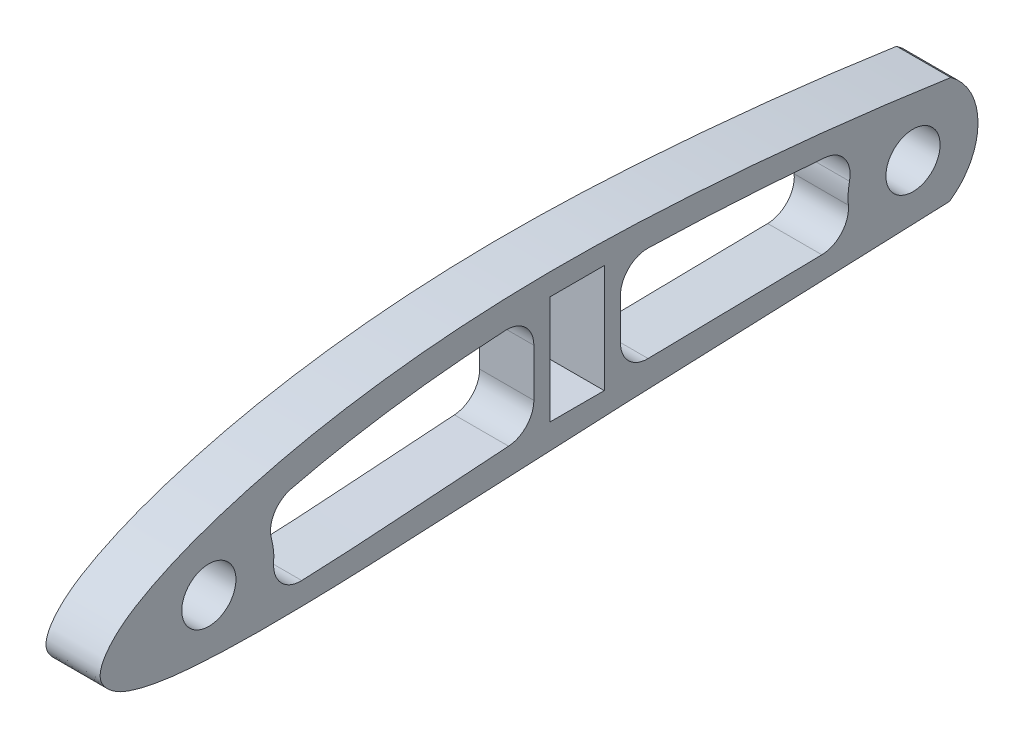
from build123d import *

# Parameters (mm, degrees)
SALIENTE_EXTRUIR1_DEPTH = 5
CROQUIS3_R              = 2.5
CORTAR_EXTRUIR1_DEPTH   = 5
CROQUIS5_W              = 5
CROQUIS5_H              = 10
CORTAR_EXTRUIR2_DEPTH   = 5
REDONDEO1_DEPTH         = 5
REDONDEO2_R             = 1
CORTAR_EXTRUIR3_DEPTH   = 121.736658037


with BuildPart() as part:
    # Croquis2 → Saliente-Extruir1 (new body)
    with BuildSketch(Plane(origin=(0, 0, 0), x_dir=(0, 0, -1), z_dir=(1, 0, 0))):
        with BuildLine():
            Line((0, 0.312), (0, 0))
            add(Edge.make_bspline(
                [(0, 0.312), (-1.997937962, 0.855883829), (-5.984172101, 1.941026774), (-13.969754476, 3.914084328), (-23.956000464, 6.094072944), (-35.967556114, 8.243020219), (-47.969800137, 10.004487706), (-59.978731703, 11.260941512), (-71.986616918, 12.044579605), (-82.010943729, 12.052504921), (-90.01480163, 11.498771412), (-96.025805434, 10.769404695), (-102.049800649, 9.693800408), (-107.041673173, 8.400233687), (-111.041923446, 7.093785184), (-114.058204626, 5.860437414), (-116.631860078, 4.526604372), (-118.865795122, 2.93110484), (-120.810450078, 0.365036715), (-118.71145095, -1.597439419), (-116.569629865, -2.367784281), (-114.018868253, -2.887733145), (-111.006425112, -3.152089705), (-107.001663144, -3.339180047), (-101.998747691, -3.325166853), (-95.997395823, -3.157228981), (-90.000278469, -2.837463999), (-82.000247102, -2.463308415), (-72.001915622, -1.983166009), (-59.999653911, -1.532308544), (-48.001247876, -1.031669763), (-36.00169377, -0.605253895), (-24.001178347, -0.29159827), (-14.000300294, -0.132346287), (-6.000182393, -0.027470629), (-2.000024799, -0.009156712), (0, 0)],
                knots=[0, 0, 0, 0, 0.025304886, 0.050487653, 0.100520433, 0.150190716, 0.199586607, 0.248740009, 0.297715539, 0.346600594, 0.371102737, 0.395726297, 0.420570145, 0.445825119, 0.458702216, 0.471919982, 0.485786003, 0.493461051, 0.506863029, 0.51614777, 0.522766003, 0.535269014, 0.547551134, 0.559786371, 0.584228898, 0.60868081, 0.633151284, 0.657621757, 0.706558114, 0.75548187, 0.804405627, 0.853320224, 0.902221408, 0.951113136, 0.975557228, 1, 1, 1, 1], degree=3))
        make_face()
    extrude(amount=SALIENTE_EXTRUIR1_DEPTH)

    # Croquis3 → Cortar-Extruir1 (cut)
    with BuildSketch(Plane(origin=(5, 0, 0), x_dir=(0, 0, -1), z_dir=(1, 0, 0))):
        with Locations((-110, 1.906)):
            Circle(CROQUIS3_R)
        with Locations((-45, 4.156)):
            Circle(CROQUIS3_R)
        with BuildLine():
            Line((-72.000000017, 9.416000001), (-72.000000017, 0.495999999))
            add(Edge.make_bspline(
                [(-72.000000017, 0.495999999), (-68.01129666, 0.575920018), (-60.685821656, 0.684456619), (-53.360874788, 0.820935125), (-50.024643764, 0.876830129)],
                knots=[0.706558114, 0.706558114, 0.706558114, 0.706558114, 0.75548187, 0.796400089, 0.796400089, 0.796400089, 0.796400089], degree=3))
            ThreePointArc((-50.024643764, 0.876830129), (-50.985037611, 4.579467585), (-49.512866043, 8.109990399))
            add(Edge.make_bspline(
                [(-49.512866043, 8.109990399), (-52.983421467, 8.449081108), (-60.471100907, 9.046835898), (-67.976381823, 9.371658422), (-72.000000017, 9.416000001)],
                knots=[0.206289007, 0.206289007, 0.206289007, 0.206289007, 0.248740009, 0.297715539, 0.297715539, 0.297715539, 0.297715539], degree=3))
        make_face()
        with BuildLine():
            Line((-80, 9.491041744), (-80, 0.132962651))
            add(Edge.make_bspline(
                [(-104.942522523, -1.322300105), (-104.02844512, -1.304513093), (-101.094064778, -1.218428736), (-96.141207098, -0.982427522), (-90.090644536, -0.540517181), (-84.708866135, -0.182788773), (-81.345393913, 0.043128867), (-80, 0.132962651)],
                knots=[0.57316863, 0.57316863, 0.57316863, 0.57316863, 0.584228898, 0.60868081, 0.633151284, 0.657621757, 0.673934787, 0.673934787, 0.673934787, 0.673934787], degree=3))
            ThreePointArc((-104.942522523, -1.322300105), (-104.014074088, 2.316720069), (-105.430858936, 5.794823721))
            add(Edge.make_bspline(
                [(-80, 9.491041744), (-81.321099881, 9.446121253), (-84.626183418, 9.287675361), (-89.912800709, 8.827841386), (-95.854977781, 7.999925906), (-101.037837976, 6.979596219), (-104.212985807, 6.146867345), (-105.430858936, 5.794823721)],
                knots=[0.33030001, 0.33030001, 0.33030001, 0.33030001, 0.346600594, 0.371102737, 0.395726297, 0.420570145, 0.436202252, 0.436202252, 0.436202252, 0.436202252], degree=3))
        make_face()
        with BuildLine():
            ThreePointArc((-39.747862708, 1.255128774), (-39.007320379, 3.859704601), (-39.487323452, 6.524627721))
            add(Edge.make_bspline(
                [(-15, 1.848248895), (-18.149785119, 2.575980355), (-25.155220919, 4.084600766), (-33.337238661, 5.554150579), (-38.353786594, 6.350514551), (-39.487323452, 6.524627721)],
                knots=[0.059687027, 0.059687027, 0.059687027, 0.059687027, 0.100520433, 0.150190716, 0.164676314, 0.164676314, 0.164676314, 0.164676314], degree=3))
            add(Edge.make_bspline(
                [(-39.747862708, 1.255128774), (-38.522933592, 1.296668404), (-33.432243502, 1.462543319), (-25.183187553, 1.68029012), (-18.158050573, 1.800552691), (-15, 1.848248895)],
                knots=[0.837824168, 0.837824168, 0.837824168, 0.837824168, 0.853320224, 0.902221408, 0.942154078, 0.942154078, 0.942154078, 0.942154078], degree=3))
        make_face()
    extrude(amount=-CORTAR_EXTRUIR1_DEPTH, mode=Mode.SUBTRACT)

    # Croquis5 → Cortar-Extruir2 (cut)
    with BuildSketch(Plane(origin=(5, 0, 0), x_dir=(0, 0, -1), z_dir=(1, 0, 0))):
        with Locations((-76.000000008, 5)):
            Rectangle(CROQUIS5_W, CROQUIS5_H)
    extrude(amount=-CORTAR_EXTRUIR2_DEPTH, mode=Mode.SUBTRACT)

    # Redondeo1: read off the stored shape, not the designer's step
    # Redondeo1 outline → Redondeo1 (add)
    with BuildSketch(Plane.YZ):
        with BuildLine():
            ThreePointArc((1.363625327, 36.42666084), (2.055490703, 38.232815236), (3.828859747, 39.004847381))
            ThreePointArc((3.828859747, 39.004847381), (5.523952088, 38.02298814), (5.990815999, 36.120509834))
            add(Edge.make_bspline(
                [(5.990815999, 36.120509834), (6.174011226, 37.241939564), (6.352115292, 38.364207973), (6.524627721, 39.487323452)],
                knots=[0.150323892, 0.150323892, 0.150323892, 0.150323892, 0.164676314, 0.164676314, 0.164676314, 0.164676314], degree=3))
            ThreePointArc((6.524627721, 39.487323452), (3.859704602, 39.007320379), (1.255128774, 39.747862708))
            add(Edge.make_bspline(
                [(1.255128774, 39.747862708), (1.292669932, 38.640841355), (1.328884057, 37.53377482), (1.363625327, 36.42666084)],
                knots=[0.837824168, 0.837824168, 0.837824168, 0.837824168, 0.851828623, 0.851828623, 0.851828623, 0.851828623], degree=3))
        make_face()
        with BuildLine():
            ThreePointArc((3.507984743, 104.217816599), (5.438808007, 103.965886257), (6.603235414, 102.405227362))
            add(Edge.make_bspline(
                [(6.603235414, 102.405227362), (6.354095177, 103.418967512), (6.084783867, 104.427759758), (5.794823721, 105.430858936)],
                knots=[0.423326893, 0.423326893, 0.423326893, 0.423326893, 0.436202252, 0.436202252, 0.436202252, 0.436202252], degree=3))
            ThreePointArc((5.794823721, 105.430858936), (4.717603159, 104.699538919), (3.507984743, 104.217816599))
        make_face()
        with BuildLine():
            add(Edge.make_bspline(
                [(9.491041744, 80), (9.461187046, 80.878018844), (9.423214515, 81.755716332), (9.376506926, 82.632925827)],
                knots=[0.33030001, 0.33030001, 0.33030001, 0.33030001, 0.341133574, 0.341133574, 0.341133574, 0.341133574], degree=3))
            ThreePointArc((9.376506926, 82.632925827), (8.694197985, 80.779871308), (6.880043283, 80))
            Line((6.880043283, 80), (9.491041744, 80))
        make_face()
        with BuildLine():
            ThreePointArc((-1.217346892, 101.42745145), (-0.455395505, 103.321781492), (1.464700492, 104.016250779))
            ThreePointArc((1.464700492, 104.016250779), (0.013650887, 104.306230174), (-1.322300105, 104.942522523))
            add(Edge.make_bspline(
                [(-1.322300105, 104.942522523), (-1.304513093, 104.02844512), (-1.270137307, 102.856668551), (-1.227208305, 101.685224677), (-1.217346892, 101.42745145)],
                knots=[0.57316863, 0.57316863, 0.57316863, 0.57316863, 0.584228898, 0.587349593, 0.587349593, 0.587349593, 0.587349593], degree=3))
        make_face()
        with BuildLine():
            Line((0.132962651, 80), (2.471241745, 80))
            ThreePointArc((2.471241745, 80), (0.76358821, 80.674097646), (-0.023165141, 82.332864476))
            add(Edge.make_bspline(
                [(-0.023165141, 82.332864476), (0.028938373, 81.555247835), (0.081039245, 80.777629876), (0.132962651, 80)],
                knots=[0.66450595, 0.66450595, 0.66450595, 0.66450595, 0.673934787, 0.673934787, 0.673934787, 0.673934787], degree=3))
        make_face()
        with BuildLine():
            ThreePointArc((8.438158575, 53.096140642), (7.43338444, 51.298795363), (5.420409596, 50.865259446))
            ThreePointArc((5.420409596, 50.865259446), (6.8513973, 50.360488167), (8.109990399, 49.512866043))
            add(Edge.make_bspline(
                [(8.109990399, 49.512866043), (8.226624149, 50.706599409), (8.335976911, 51.901055686), (8.438158575, 53.096140642)],
                knots=[0.206289007, 0.206289007, 0.206289007, 0.206289007, 0.220890467, 0.220890467, 0.220890467, 0.220890467], degree=3))
        make_face()
        with BuildLine():
            ThreePointArc((0.876830129, 50.024643764), (2.163659753, 50.65955655), (3.564442647, 50.970767111))
            ThreePointArc((3.564442647, 50.970767111), (1.655977789, 51.591017802), (0.818348025, 53.414565283))
            add(Edge.make_bspline(
                [(0.818348025, 53.414565283), (0.838248228, 52.2845983), (0.857898456, 51.154627293), (0.876830129, 50.024643764)],
                knots=[0.782541063, 0.782541063, 0.782541063, 0.782541063, 0.796400089, 0.796400089, 0.796400089, 0.796400089], degree=3))
        make_face()
        with BuildLine():
            ThreePointArc((6.871491343, 72.000000017), (8.660450653, 71.246317453), (9.370764011, 69.439699686))
            add(Edge.make_bspline(
                [(9.370764011, 69.439699686), (9.391351193, 70.29297827), (9.406593246, 71.146417681), (9.416000001, 72.000000017)],
                knots=[0.287325724, 0.287325724, 0.287325724, 0.287325724, 0.297715539, 0.297715539, 0.297715539, 0.297715539], degree=3))
            Line((9.416000001, 72.000000017), (6.871491343, 72.000000017))
        make_face()
        with BuildLine():
            add(Edge.make_bspline(
                [(0.495999999, 72.000000017), (0.512999759, 71.151564312), (0.529057688, 70.303110091), (0.544453868, 69.4546428)],
                knots=[0.706558114, 0.706558114, 0.706558114, 0.706558114, 0.716964669, 0.716964669, 0.716964669, 0.716964669], degree=3))
            ThreePointArc((0.544453868, 69.4546428), (1.260311311, 71.251657369), (3.044042379, 72.000000017))
            Line((3.044042379, 72.000000017), (0.495999999, 72.000000017))
        make_face()
    extrude(amount=REDONDEO1_DEPTH)

    # Redondeo2
    redondeo2_edges = [part.edges().sort_by_distance(p)[0] for p in [
        (2.5, 1.848248895, 15),
    ]]
    fillet(redondeo2_edges, radius=REDONDEO2_R)

    # Croquis6 → Cortar-Extruir3 (cut, through all)
    with BuildSketch(Plane(origin=(5, 0, 0), x_dir=(0, 0, -1), z_dir=(1, 0, 0))):
        with BuildLine():
            Line((0, 0.312), (0, 0))
            add(Edge.make_bspline(
                [(-41.631818861, -0.809415976), (-39.754670618, -0.74391656), (-33.878213807, -0.549752826), (-24.001178347, -0.29159827), (-14.000300294, -0.132346287), (-6.000182393, -0.027470629), (-2.000024799, -0.009156712), (0, 0)],
                knots=[0.830365383, 0.830365383, 0.830365383, 0.830365383, 0.853320224, 0.902221408, 0.951113136, 0.975557228, 1, 1, 1, 1], degree=3))
            ThreePointArc((-41.631818861, -0.809415976), (-39.000438464, 4.083464651), (-41.512756089, 9.038533144))
            add(Edge.make_bspline(
                [(0, 0.312), (-1.997937962, 0.855883829), (-5.984172101, 1.941026774), (-13.969754476, 3.914084328), (-23.956000464, 6.094072944), (-33.818855926, 7.85860345), (-39.672984761, 8.768238641), (-41.512756089, 9.038533144)],
                knots=[0, 0, 0, 0, 0.025304886, 0.050487653, 0.100520433, 0.150190716, 0.172914879, 0.172914879, 0.172914879, 0.172914879], degree=3))
        make_face()
    extrude(amount=-CORTAR_EXTRUIR3_DEPTH, mode=Mode.SUBTRACT)


solid = part.part
